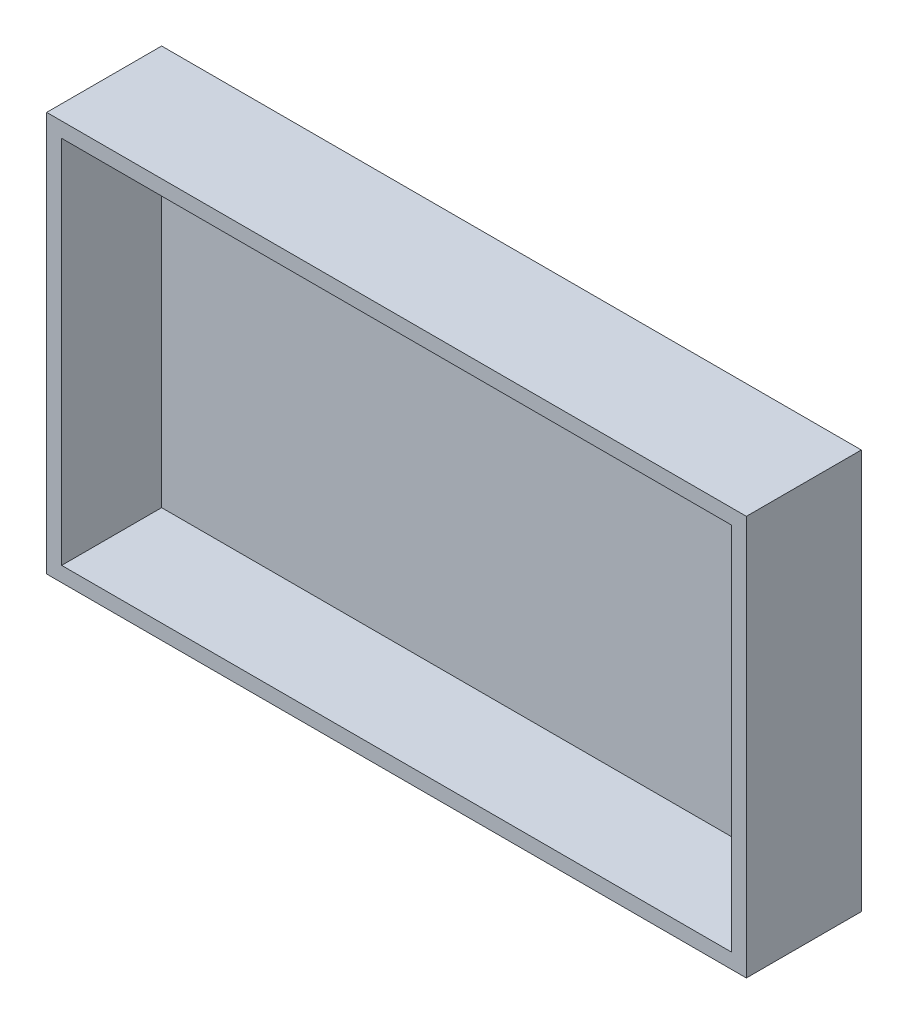
from build123d import *

# Parameters (mm, degrees)
SKETCH_1_W      = 70
SKETCH_1_H      = 40
EXTRUDE_1_DEPTH = 11.5
SHELL_1_T       = -1.5


with BuildPart() as part:
    # 草图1 → 凸台-拉伸1 (new body)
    with BuildSketch(Plane.XY):
        Rectangle(SKETCH_1_W, SKETCH_1_H)
    extrude(amount=EXTRUDE_1_DEPTH)

    # 抽壳1
    shell_1_openings = [part.faces().sort_by_distance(p)[0] for p in [
        (0, 0, 11.5),
    ]]
    offset(amount=SHELL_1_T, openings=shell_1_openings, kind=Kind.INTERSECTION)


solid = part.part
